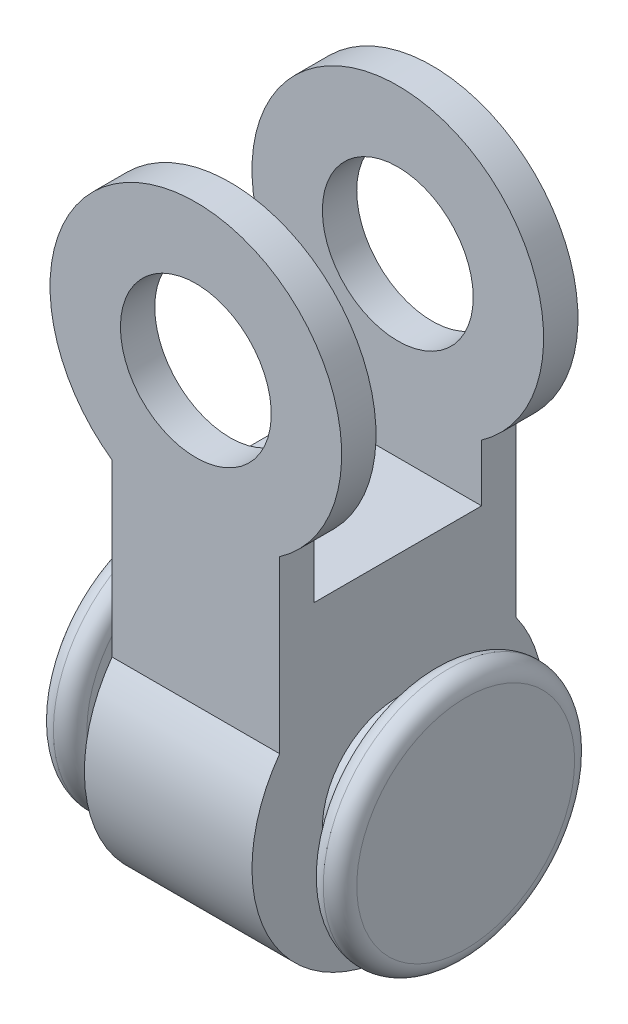
from build123d import *

# Parameters (mm, degrees)
SKETCH1_R                = 87
BOSS_EXTRUDE3_DEPTH      = 100
SKETCH2_R                = 45
BOSS_EXTRUDE4_DEPTH      = 20.5
SKETCH3_R                = 75
BOSS_EXTRUDE5_DEPTH      = 20
FILLET1_R                = 10
BOSS_EXTRUDE6_START      = 20.5
SKETCH4_R                = 45
BOSS_EXTRUDE6_DEPTH      = 20.5
BOSS_EXTRUDE7_START      = 20
SKETCH5_R                = 75
BOSS_EXTRUDE7_DEPTH      = 20
FILLET2_R                = 10
BOSS_EXTRUDE8_REACH      = 241.969
BOSS_EXTRUDE8_END_RADIUS = 87
SKETCH6_W                = 100
SKETCH6_H                = 141
SKETCH9_R                = 45
BOSS_EXTRUDE10_DEPTH     = 141
CUT_EXTRUDE2_DEPTH       = 374.425025993
CUT_EXTRUDE2_DEPTH_BACK  = 374.425025993
SKETCH21_W               = 216.769628827
SKETCH21_H               = 100


with BuildPart() as part:
    # Sketch1 → Boss-Extrude3 (new body)
    with BuildSketch(Plane(origin=(0, 0, 0), x_dir=(0, 0, -1), z_dir=(1, 0, 0))):
        Circle(SKETCH1_R)
    extrude(amount=BOSS_EXTRUDE3_DEPTH)

    # Sketch2 → Boss-Extrude4 (add)
    with BuildSketch(Plane(origin=(100, 0, 0), x_dir=(0, 0, -1), z_dir=(1, 0, 0))):
        Circle(SKETCH2_R)
    extrude(amount=BOSS_EXTRUDE4_DEPTH)

    # Sketch3 → Boss-Extrude5 (add)
    with BuildSketch(Plane(origin=(120.5, 0, 0), x_dir=(0, 0, -1), z_dir=(1, 0, 0))):
        Circle(SKETCH3_R)
    extrude(amount=BOSS_EXTRUDE5_DEPTH)

    # Fillet1
    fillet1_edges = [part.edges().sort_by_distance(p)[0] for p in [
        (140.5, 0, 75),
        (120.5, 0, 75),
    ]]
    fillet(fillet1_edges, radius=FILLET1_R - 0.0001)  # a hair under: the kernel refuses the full size

    # Sketch4 → Boss-Extrude6 (add)
    with BuildSketch(Plane.ZY.offset(BOSS_EXTRUDE6_START)):
        with Locations(Location((0, 0, 0), (0, 0, 180))):
            Circle(SKETCH4_R)
    extrude(amount=-BOSS_EXTRUDE6_DEPTH)

    # Sketch5 → Boss-Extrude7 (add)
    with BuildSketch(Plane.ZY.offset(20.5).offset(BOSS_EXTRUDE7_START)):
        Circle(SKETCH5_R)
    extrude(amount=-BOSS_EXTRUDE7_DEPTH)

    # Fillet2
    fillet2_edges = [part.edges().sort_by_distance(p)[0] for p in [
        (-20.5, 0, -75),
        (-40.5, 0, -75),
    ]]
    fillet(fillet2_edges, radius=FILLET2_R - 0.0001)  # a hair under: the kernel refuses the full size

    # Boss-Extrude8: up to this cylinder (the profile starts outside it)
    boss_extrude8_end = Plane(origin=(50, 0, 0), z_dir=(-1, 0, 0)) * Cylinder(BOSS_EXTRUDE8_END_RADIUS, 658.938, mode=Mode.PRIVATE)
    # Sketch6 → Boss-Extrude8 (add, up to the surface)
    with BuildSketch(Plane(origin=(0, 87, 0), x_dir=(1, 0, 0), z_dir=(0, 1, 0)), mode=Mode.PRIVATE) as boss_extrude8_sk1:
        with Locations((50, 0)):
            Rectangle(SKETCH6_W, SKETCH6_H)
    boss_extrude8_tool1 = extrude(boss_extrude8_sk1.sketch, amount=-BOSS_EXTRUDE8_REACH, mode=Mode.PRIVATE) - boss_extrude8_end
    add(boss_extrude8_tool1.solids().sort_by_distance((50, 87, 0))[0])
    add(boss_extrude8_tool1.solids().sort_by_distance((50, 87, 0))[1])

    # Sketch9 → Boss-Extrude10 (add)
    with BuildSketch(Plane(origin=(0, 0, -70.5), x_dir=(-1, 0, 0), z_dir=(0, 0, -1))):
        with BuildLine():
            Line((-100, 87), (0, 87))
            Line((0, 87), (0, 152.803089955))
            ThreePointArc((0, 152.803089955), (-50, 311), (-100, 152.803089955))
            Line((-100, 152.803089955), (-100, 87))
        make_face()
        with Locations((-50, 224)):
            Circle(SKETCH9_R, mode=Mode.SUBTRACT)
    extrude(amount=-BOSS_EXTRUDE10_DEPTH)

    # Sketch21 → Cut-Extrude2 (cut, two sides: drawn at the far end of the back side and taken through both)
    with BuildSketch(Plane(origin=(147, 0, 0), x_dir=(0, 1, 0), z_dir=(-1, 0, 0)).offset(-CUT_EXTRUDE2_DEPTH_BACK)):
        with Locations((227.184814414, 0)):
            Rectangle(SKETCH21_W, SKETCH21_H)
    extrude(amount=CUT_EXTRUDE2_DEPTH + CUT_EXTRUDE2_DEPTH_BACK, mode=Mode.SUBTRACT)


solid = part.part
